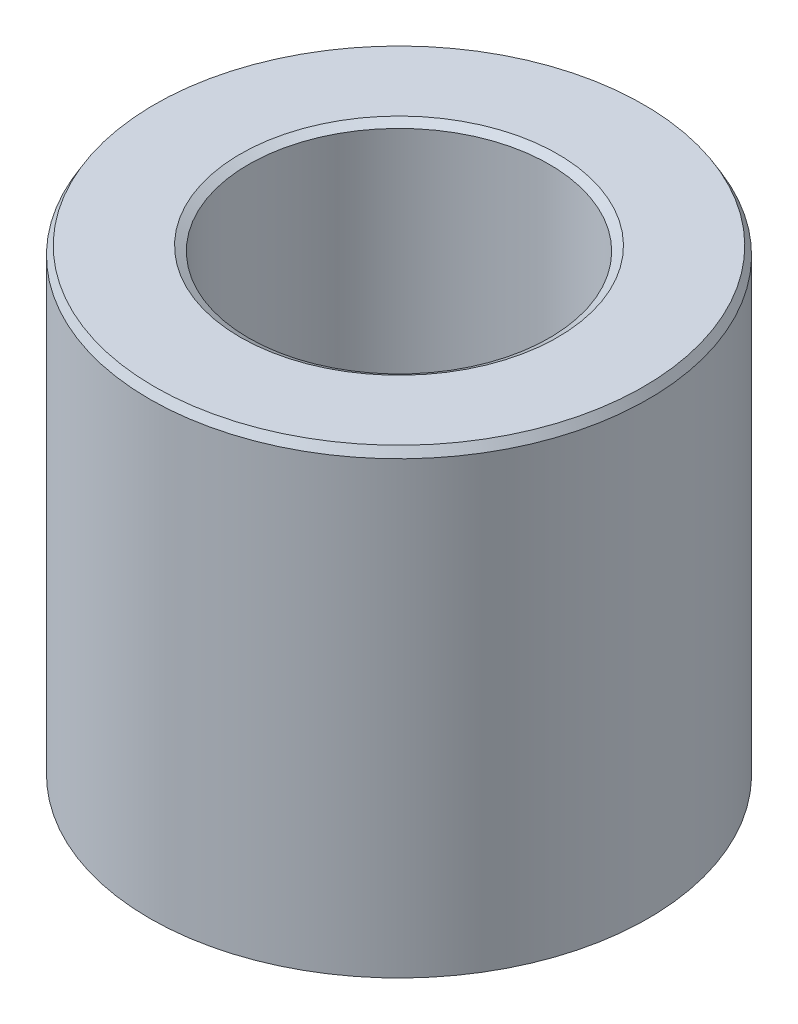
from build123d import *
from OCP.BRepFilletAPI import BRepFilletAPI_MakeChamfer

# Parameters (mm, degrees)
SKETCH1_R           = 60
BOSS_EXTRUDE1_DEPTH = 111.378244647
SKETCH2_R           = 36.195405856
CUT_EXTRUDE1_DEPTH  = 141.018260883
CHAMFER1_SIZE       = 2.005419471
CHAMFER1_SIZE2      = 1.157829472


with BuildPart() as part:
    # Sketch1 → Boss-Extrude1 (new body)
    with BuildSketch(Plane(origin=(0, 0, 0), x_dir=(1, 0, 0), z_dir=(0, 1, 0))):
        Circle(SKETCH1_R)
    extrude(amount=BOSS_EXTRUDE1_DEPTH)

    # Sketch2 → Cut-Extrude1 (cut, through all)
    with BuildSketch(Plane(origin=(0, 0, 0), x_dir=(1, 0, 0), z_dir=(0, 1, 0))):
        Circle(SKETCH2_R)
    extrude(amount=CUT_EXTRUDE1_DEPTH, mode=Mode.SUBTRACT)

    # Chamfer1: one chamfer whose edges measure the first distance from different faces: ONE call of the kernel's chamfer builder (chamfer() names one face for all edges)
    chamfer1_edges_1 = [part.edges().sort_by_distance(p)[0] for p in [
        (-36.195405856, 111.378244647, 0),
    ]]
    chamfer1_side_1 = [part.faces().sort_by_distance(p)[0] for p in [
        (-58.302943725, 111.378244647, 0),
    ]]
    chamfer1_edges_2 = [part.edges().sort_by_distance(p)[0] for p in [
        (-36.195405856, 0, 0),
    ]]
    chamfer1_side_2 = [part.faces().sort_by_distance(p)[0] for p in [
        (-36.195405856, 55.689122323, 0),
    ]]
    chamfer1_edges_3 = [part.edges().sort_by_distance(p)[0] for p in [
        (-60, 0, 0),
    ]]
    chamfer1_side_3 = [part.faces().sort_by_distance(p)[0] for p in [
        (-58.302943725, 0, 0),
    ]]
    chamfer1_edges_4 = [part.edges().sort_by_distance(p)[0] for p in [
        (-60, 111.378244647, 0),
    ]]
    chamfer1_side_4 = [part.faces().sort_by_distance(p)[0] for p in [
        (-60, 55.689122323, 0),
    ]]
    chamfer1 = BRepFilletAPI_MakeChamfer(part.part.solid().wrapped)
    for e in chamfer1_edges_1:
        chamfer1.Add(CHAMFER1_SIZE, CHAMFER1_SIZE2, e.wrapped, chamfer1_side_1[0].wrapped)  # the first distance lies on this face
    for e in chamfer1_edges_2:
        chamfer1.Add(CHAMFER1_SIZE, CHAMFER1_SIZE2, e.wrapped, chamfer1_side_2[0].wrapped)  # the first distance lies on this face
    for e in chamfer1_edges_3:
        chamfer1.Add(CHAMFER1_SIZE, CHAMFER1_SIZE2, e.wrapped, chamfer1_side_3[0].wrapped)  # the first distance lies on this face
    for e in chamfer1_edges_4:
        chamfer1.Add(CHAMFER1_SIZE, CHAMFER1_SIZE2, e.wrapped, chamfer1_side_4[0].wrapped)  # the first distance lies on this face
    add(Compound.cast(chamfer1.Shape()), mode=Mode.REPLACE)


solid = part.part
